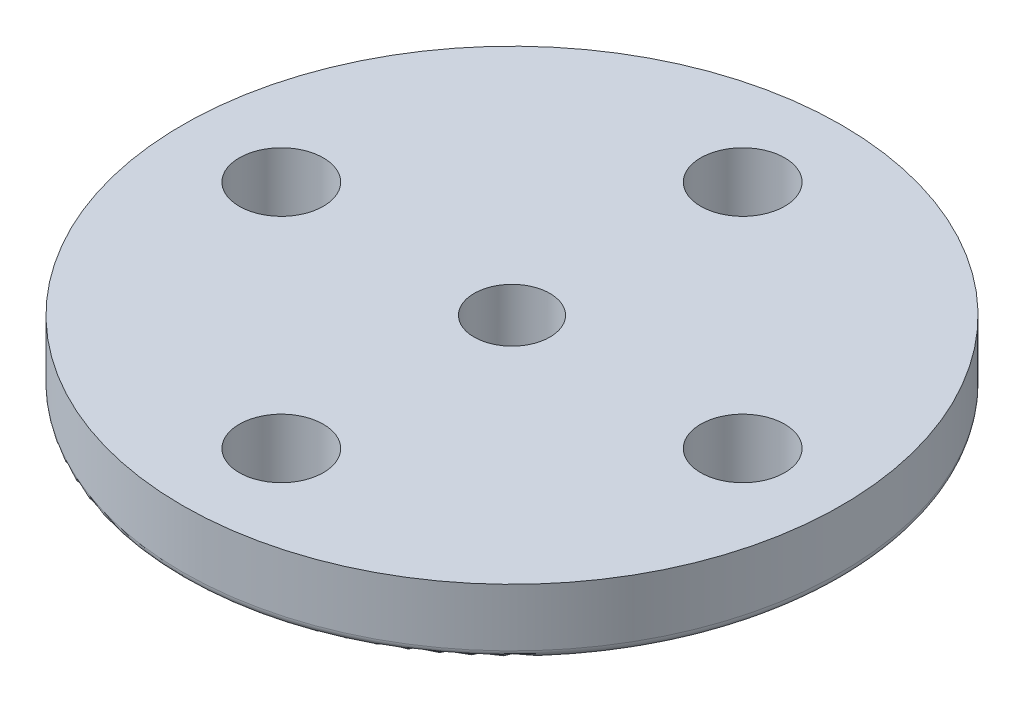
from build123d import *

# Parameters (mm, degrees)
SKETCH1_R           = 10
BOSS_EXTRUDE1_DEPTH = 2
SKETCH2_R           = 4.5
BOSS_EXTRUDE2_DEPTH = 3.5
SKETCH3_R           = 1.275
CUT_EXTRUDE1_DEPTH  = 15.568802284
FILLET1_R           = 0.25
SKETCH6_R           = 1.15
CUT_EXTRUDE2_DEPTH  = 16.173991037
SKETCH7_R           = 3.05
CUT_EXTRUDE3_DEPTH  = 2.5
BOSS_EXTRUDE4_DEPTH = 2.5
CIRPATTERN1_COUNT   = 26


with BuildPart() as part:
    # Sketch1 → Boss-Extrude1 (new body)
    with BuildSketch(Plane(origin=(0, 0, 0), x_dir=(1, 0, 0), z_dir=(0, 1, 0))):
        Circle(SKETCH1_R)
    extrude(amount=BOSS_EXTRUDE1_DEPTH)

    # Sketch2 → Boss-Extrude2 (add)
    with BuildSketch(Plane(origin=(0, 0, 0), x_dir=(1, 0, 0), z_dir=(0, 1, 0))):
        Circle(SKETCH2_R)
    extrude(amount=-BOSS_EXTRUDE2_DEPTH)

    # Sketch3 → Cut-Extrude1 (cut, through all)
    with BuildSketch(Plane(origin=(0, 0, 0), x_dir=(1, 0, 0), z_dir=(0, 1, 0))):
        with Locations((0, 7)):
            Circle(SKETCH3_R)
        with Locations((-7, 0)):
            Circle(SKETCH3_R)
        with Locations((0, -7)):
            Circle(SKETCH3_R)
        with Locations((7, 0)):
            Circle(SKETCH3_R)
    extrude(amount=CUT_EXTRUDE1_DEPTH, mode=Mode.SUBTRACT)

    # Fillet1
    fillet1_edges = [part.edges().sort_by_distance(p)[0] for p in [
        (-10, 0, 0),
    ]]
    fillet(fillet1_edges, radius=FILLET1_R)

    # Sketch6 → Cut-Extrude2 (cut, through all)
    with BuildSketch(Plane(origin=(0, 2, 0), x_dir=(1, 0, 0), z_dir=(0, 1, 0))):
        Circle(SKETCH6_R)
    extrude(amount=-CUT_EXTRUDE2_DEPTH, mode=Mode.SUBTRACT)

    # Sketch7 → Cut-Extrude3 (cut)
    with BuildSketch(Plane.XZ.offset(3.5)):
        Circle(SKETCH7_R)
    extrude(amount=-CUT_EXTRUDE3_DEPTH, mode=Mode.SUBTRACT)

    # Sketch8 → Boss-Extrude4 (add)
    with BuildSketch(Plane.XZ.offset(3.5)):
        with BuildLine():
            Line((-2.47829178, -1.102516087), (-2.873870101, -0.998522472))
            ThreePointArc((-2.873870101, -0.998522472), (-2.772433003, -1.241372581), (-2.649396953, -1.474026383))
            Line((-2.649396953, -1.474026383), (-2.47829178, -1.102516087))
        make_face()
    boss_extrude4 = extrude(amount=-BOSS_EXTRUDE4_DEPTH)

    # CirPattern1: Boss-Extrude4 ×26 about axis
    cirpattern1_axis = Axis((0, 0, 0), (0, -1, 0))
    for i in range(1, CIRPATTERN1_COUNT):
        add(boss_extrude4.rotate(cirpattern1_axis, i * 360 / CIRPATTERN1_COUNT))


solid = part.part
